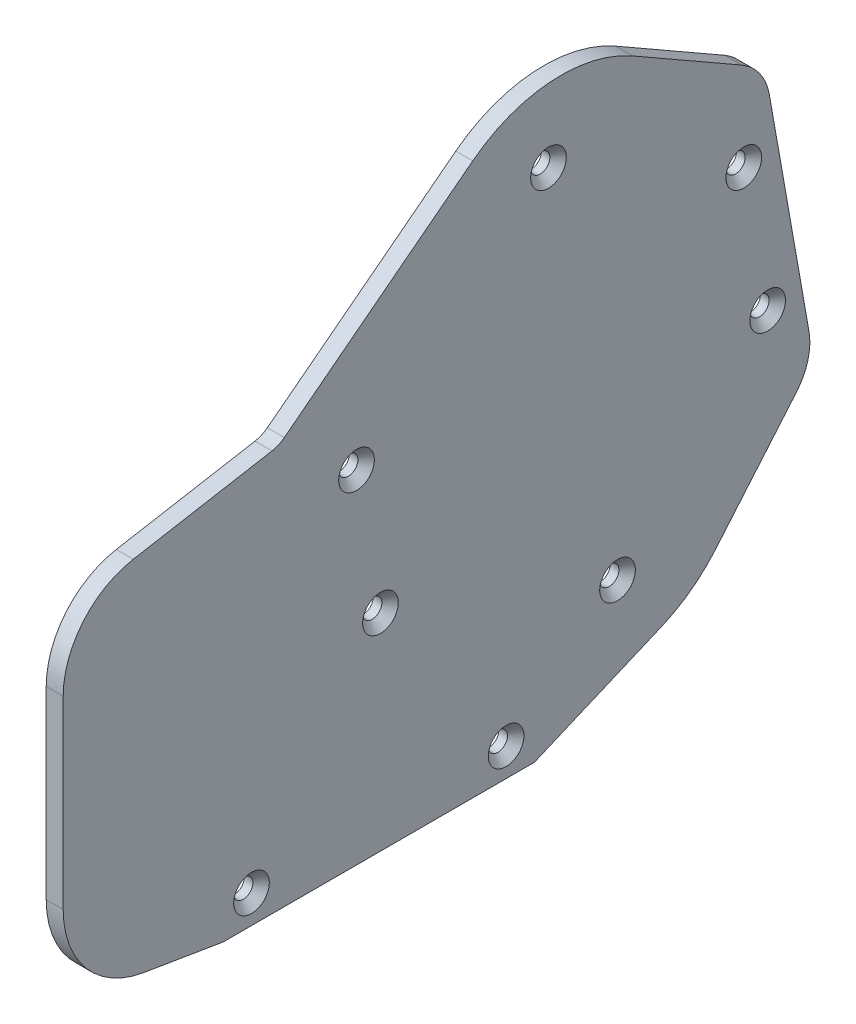
from build123d import *

# Parameters (mm, degrees)
BOSS_EXTRUDE1_DEPTH                            = 3
CSK_FOR_M3_FLAT_HEAD_MACHINE_SCREW1_AT_2_COUNT = 2
CSK_FOR_M3_FLAT_HEAD_MACHINE_SCREW1_AT_2_PITCH = 24.36335345
CSK_FOR_M3_FLAT_HEAD_MACHINE_SCREW1_AT_3_COUNT = 2
CSK_FOR_M3_FLAT_HEAD_MACHINE_SCREW1_AT_3_PITCH = 69.5
CSK_FOR_M3_FLAT_HEAD_MACHINE_SCREW1_AT_4_COUNT = 2
CSK_FOR_M3_FLAT_HEAD_MACHINE_SCREW1_AT_4_PITCH = 73.646608824
CSK_FOR_M3_FLAT_HEAD_MACHINE_SCREW1_AT_5_COUNT = 2
CSK_FOR_M3_FLAT_HEAD_MACHINE_SCREW1_AT_5_PITCH = 56.579922425
CSK_FOR_M3_FLAT_HEAD_MACHINE_SCREW1_AT_6_COUNT = 2
CSK_FOR_M3_FLAT_HEAD_MACHINE_SCREW1_AT_6_PITCH = 38.581652039
CSK_FOR_M3_FLAT_HEAD_MACHINE_SCREW1_AT_7_COUNT = 2
CSK_FOR_M3_FLAT_HEAD_MACHINE_SCREW1_AT_7_PITCH = 110.143173396
CSK_FOR_M3_FLAT_HEAD_MACHINE_SCREW1_AT_8_COUNT = 2
CSK_FOR_M3_FLAT_HEAD_MACHINE_SCREW1_AT_8_PITCH = 79.535664399


with BuildPart() as part:
    # Sketch2 → Boss-Extrude1 (new body)
    with BuildSketch(Plane(origin=(29, 0, 0), x_dir=(0, 0, -1), z_dir=(1, 0, 0))):
        with BuildLine():
            Line((16.610141275, 134.506640075), (-16.691511003, 108.816260881))
            ThreePointArc((-16.691511003, 108.816260881), (-17.725917606, 108.201192201), (-18.877327121, 107.851102741))
            Line((-18.877327121, 107.851102741), (-43.389342906, 103.528973007))
            ThreePointArc((-43.389342906, 103.528973007), (-52.275286888, 98.398670857), (-55.784620241, 88.756856712))
            Line((-55.784620241, 88.756856712), (-55.784620241, 56.108145787))
            ThreePointArc((-55.784620241, 56.108145787), (-51.753255927, 45.116581364), (-41.571151011, 39.338075833))
            Line((-41.571151011, 39.338075833), (-27.5, 37))
            Line((-27.5, 37), (27.5, 37))
            Line((27.5, 37), (49.95644752, 46.524072909))
            ThreePointArc((49.95644752, 46.524072909), (55.128189361, 49.472265428), (59.475441909, 53.539223516))
            Line((59.475441909, 53.539223516), (73.824664919, 70.516397068))
            ThreePointArc((73.824664919, 70.516397068), (75.841855651, 74.366160521), (76.03531425, 78.708085309))
            Line((76.03531425, 78.708085309), (69.026291478, 118.458228724))
            ThreePointArc((69.026291478, 118.458228724), (67.359474123, 122.47213667), (64.147238229, 125.399811115))
            Line((64.147238229, 125.399811115), (44.856843921, 136.445412513))
            ThreePointArc((44.856843921, 136.445412513), (30.439693581, 139.756494337), (16.610141275, 134.506640075))
        make_face()
    extrude(amount=BOSS_EXTRUDE1_DEPTH)

    # Sketch4 → CSK for M3 Flat Head Machine Screw1 (revolve, cut)
    with BuildSketch(Plane(origin=(32, 109.537877634, -64.506630382), x_dir=(0, 0, -1), z_dir=(0, 1, 0))):
        Polygon((0, 0), (0, 3), (1.7, 3), (1.7, 1.45), (3.15, 0), align=None)
    csk_for_m3_flat_head_machine_screw1 = revolve(axis=Axis((38.35, 109.537877634, -64.506630382), (-1, 0, 0)), mode=Mode.SUBTRACT)

    # CSK for M3 Flat Head Machine Screw1 at 2: CSK for M3 Flat Head Machine Screw1 ×2
    with Locations(*[Vector(0, -0.9848077530122096, -0.17364817766692153) * (i * CSK_FOR_M3_FLAT_HEAD_MACHINE_SCREW1_AT_2_PITCH) for i in range(1, CSK_FOR_M3_FLAT_HEAD_MACHINE_SCREW1_AT_2_COUNT)]):
        add(csk_for_m3_flat_head_machine_screw1, mode=Mode.SUBTRACT)

    # CSK for M3 Flat Head Machine Screw1 at 3: CSK for M3 Flat Head Machine Screw1 ×2
    with Locations(*[Vector(0, -0.17364817766692173, 0.9848077530122096) * (i * CSK_FOR_M3_FLAT_HEAD_MACHINE_SCREW1_AT_3_PITCH) for i in range(1, CSK_FOR_M3_FLAT_HEAD_MACHINE_SCREW1_AT_3_COUNT)]):
        add(csk_for_m3_flat_head_machine_screw1, mode=Mode.SUBTRACT)

    # CSK for M3 Flat Head Machine Screw1 at 4: CSK for M3 Flat Head Machine Screw1 ×2
    with Locations(*[Vector(0, -0.48965958230394924, 0.871913696106399) * (i * CSK_FOR_M3_FLAT_HEAD_MACHINE_SCREW1_AT_4_PITCH) for i in range(1, CSK_FOR_M3_FLAT_HEAD_MACHINE_SCREW1_AT_4_COUNT)]):
        add(csk_for_m3_flat_head_machine_screw1, mode=Mode.SUBTRACT)

    # CSK for M3 Flat Head Machine Screw1 at 5: CSK for M3 Flat Head Machine Screw1 ×2
    with Locations(*[Vector(0, -0.9189778543552553, 0.394309146742263) * (i * CSK_FOR_M3_FLAT_HEAD_MACHINE_SCREW1_AT_5_PITCH) for i in range(1, CSK_FOR_M3_FLAT_HEAD_MACHINE_SCREW1_AT_5_COUNT)]):
        add(csk_for_m3_flat_head_machine_screw1, mode=Mode.SUBTRACT)

    # CSK for M3 Flat Head Machine Screw1 at 6: CSK for M3 Flat Head Machine Screw1 ×2
    with Locations(*[Vector(0, 0.44674834840291716, 0.8946596633353188) * (i * CSK_FOR_M3_FLAT_HEAD_MACHINE_SCREW1_AT_6_PITCH) for i in range(1, CSK_FOR_M3_FLAT_HEAD_MACHINE_SCREW1_AT_6_COUNT)]):
        add(csk_for_m3_flat_head_machine_screw1, mode=Mode.SUBTRACT)

    # CSK for M3 Flat Head Machine Screw1 at 7: CSK for M3 Flat Head Machine Screw1 ×2
    with Locations(*[Vector(0, -0.6131826018071209, 0.7899411983439336) * (i * CSK_FOR_M3_FLAT_HEAD_MACHINE_SCREW1_AT_7_PITCH) for i in range(1, CSK_FOR_M3_FLAT_HEAD_MACHINE_SCREW1_AT_7_COUNT)]):
        add(csk_for_m3_flat_head_machine_screw1, mode=Mode.SUBTRACT)

    # CSK for M3 Flat Head Machine Screw1 at 8: CSK for M3 Flat Head Machine Screw1 ×2
    with Locations(*[Vector(0, -0.849152114899921, 0.5281483558253223) * (i * CSK_FOR_M3_FLAT_HEAD_MACHINE_SCREW1_AT_8_PITCH) for i in range(1, CSK_FOR_M3_FLAT_HEAD_MACHINE_SCREW1_AT_8_COUNT)]):
        add(csk_for_m3_flat_head_machine_screw1, mode=Mode.SUBTRACT)


solid = part.part
